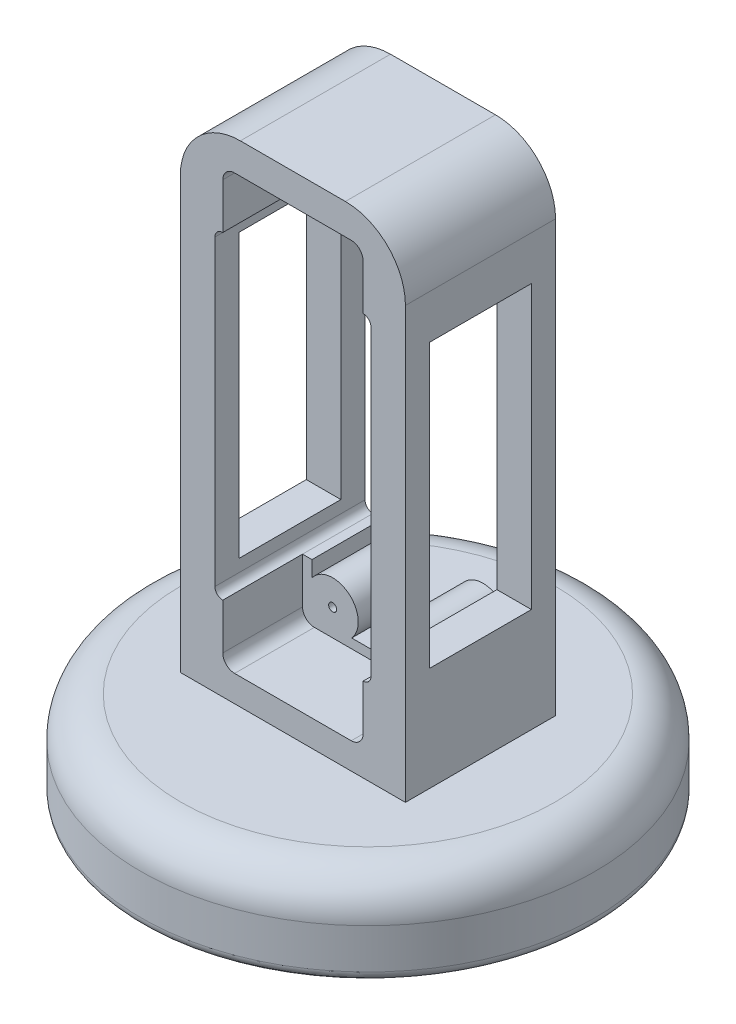
from build123d import *

# Parameters (mm, degrees)
BOSS_EXTRUDE1_DEPTH   = 19.05
SKETCH2_R             = 28.829
BOSS_EXTRUDE3_DEPTH   = 11.43
FILLET1_R             = 7.62
FILLET2_R             = 5.08
FILLET3_R             = 1.27
CAVITY4_OUTLINE_R     = 0.5
CAVITY4_DEPTH         = 19.05
CAVITY4_START         = 16.55
CAVITY4_2_OUTLINE_R   = 2.25
CAVITY4_2_OUTLINE_R_2 = 0.5
CAVITY4_2_DEPTH       = 2.5
CAVITY4_START_2       = 18.05
CAVITY4_3_DEPTH       = 1
CAVITY4_START_3       = 5.35
CAVITY4_4_OUTLINE_R   = 0.5
CAVITY4_4_DEPTH       = 11.2
CUT_EXTRUDE2_DEPTH    = 25.4
CUT_EXTRUDE3_START    = -19.558
CUT_EXTRUDE3_DEPTH    = 19.558
SKETCH6_R             = 2.25
BOSS_EXTRUDE4_DEPTH   = 2.54
SKETCH7_W             = 12.923913796
SKETCH7_H             = 35.830978878
CUT_EXTRUDE4_DEPTH    = 33.02
CUT_EXTRUDE6_START    = -5.08
SKETCH8_R             = 2.25
CUT_EXTRUDE6_DEPTH    = 5.08
SKETCH9_R             = 0.508
CUT_EXTRUDE7_DEPTH    = 17.78
CUT_EXTRUDE8_START    = -7.62
CUT_EXTRUDE8_DEPTH    = 7.62


# Read off the part's stored shape, not the designer's step: Cavity4
with BuildPart() as part:
    # Sketch1 → Boss-Extrude1 (new body)
    with BuildSketch(Plane.XY):
        Polygon((0, -31.115), (13.97, -31.115), (13.97, 0), (13.97, 31.115), (-0.624344695, 31.115), (-14.594344695, 31.115), (-14.594344695, 0), (-14.594344695, -31.115), align=None)
    extrude(amount=BOSS_EXTRUDE1_DEPTH)

    # Sketch2 → Boss-Extrude3 (add)
    with BuildSketch(Plane.XZ.offset(31.115)):
        with Locations(Location((-0.312172348, 9.525, 0), (0, 0, 270))):
            Circle(SKETCH2_R)
    extrude(amount=BOSS_EXTRUDE3_DEPTH)

    # Fillet1
    fillet1_edges = [part.edges().sort_by_distance(p)[0] for p in [
        (-14.594344695, 31.115, 9.525),
        (13.97, 31.115, 9.525),
    ]]
    fillet(fillet1_edges, radius=FILLET1_R)

    # Fillet2
    fillet2_edges = [part.edges().sort_by_distance(p)[0] for p in [
        (-0.312172348, -31.115, 38.354),
    ]]
    fillet(fillet2_edges, radius=FILLET2_R)

    # Fillet3
    fillet3_edges = [part.edges().sort_by_distance(p)[0] for p in [
        (-0.312172348, -42.545, 38.354),
    ]]
    fillet(fillet3_edges, radius=FILLET3_R)

    # Cavity4 outline → Cavity4 (cut)
    with BuildSketch(Plane.XY):
        with BuildLine():
            Line((8.593365051, 19.922544312), (-9.206634949, 19.922544312))
            ThreePointArc((-9.206634949, 19.922544312), (-9.91374173, 19.629651093), (-10.206634949, 18.922544312))
            Line((-10.206634949, 18.922544312), (-10.206634949, -19.477455688))
            ThreePointArc((-10.206634949, -19.477455688), (-9.91374173, -20.184562469), (-9.206634949, -20.477455688))
            Line((-9.206634949, -20.477455688), (8.593365051, -20.477455688))
            ThreePointArc((8.593365051, -20.477455688), (9.300471832, -20.184562469), (9.593365051, -19.477455688))
            Line((9.593365051, -19.477455688), (9.593365051, 18.922544312))
            ThreePointArc((9.593365051, 18.922544312), (9.300471832, 19.629651094), (8.593365051, 19.922544312))
        make_face()
        with Locations((-9.206634949, -19.477455688)):
            Circle(CAVITY4_OUTLINE_R, mode=Mode.SUBTRACT)
        with Locations((8.593365051, -19.477455688)):
            Circle(CAVITY4_OUTLINE_R, mode=Mode.SUBTRACT)
        with Locations((-9.206634949, 18.922544312)):
            Circle(CAVITY4_OUTLINE_R, mode=Mode.SUBTRACT)
        with Locations((8.593365051, 18.922544312)):
            Circle(CAVITY4_OUTLINE_R, mode=Mode.SUBTRACT)
    extrude(amount=CAVITY4_DEPTH, mode=Mode.SUBTRACT)

    # Cavity4 2 outline → Cavity4 2 (cut)
    # profile 1 of 6: a face of its own
    with BuildSketch(Plane.XY.offset(CAVITY4_START)):
        with BuildLine():
            ThreePointArc((-8.006634949, 21.929499851), (-3.337656866, 21.329809919), (-2.96721353, 26.022544312))
            Line((-2.96721353, 26.022544312), (2.353943633, 26.022544312))
            ThreePointArc((2.353943633, 26.022544312), (2.724386969, 21.329809919), (7.393365051, 21.929499851))
            Line((7.393365051, 21.929499851), (7.393365051, 19.922544312))
            Line((7.393365051, 19.922544312), (8.593365051, 19.922544312))
            Line((8.593365051, 19.922544312), (8.593365051, 25.722544312))
            ThreePointArc((8.593365051, 25.722544312), (8.154025223, 26.783204484), (7.093365051, 27.222544312))
            Line((7.093365051, 27.222544312), (-7.706634949, 27.222544312))
            ThreePointArc((-7.706634949, 27.222544312), (-8.76729512, 26.783204484), (-9.206634949, 25.722544312))
            Line((-9.206634949, 25.722544312), (-9.206634949, 19.922544312))
            Line((-9.206634949, 19.922544312), (-8.006634949, 19.922544312))
            Line((-8.006634949, 19.922544312), (-8.006634949, 21.929499851))
        make_face()
        with Locations((-5.386634949, 23.852544312)):
            Circle(CAVITY4_2_OUTLINE_R, mode=Mode.SUBTRACT)
        with Locations((4.773365051, 23.852544312)):
            Circle(CAVITY4_2_OUTLINE_R, mode=Mode.SUBTRACT)
    # profile 2 of 6: a face of its own
    with BuildSketch(Plane.XY.offset(CAVITY4_START)):
        with BuildLine():
            Line((-8.006634949, -20.477455688), (-9.206634949, -20.477455688))
            Line((-9.206634949, -20.477455688), (-9.206634949, -26.277455688))
            ThreePointArc((-9.206634949, -26.277455688), (-8.76729512, -27.33811586), (-7.706634949, -27.777455688))
            Line((-7.706634949, -27.777455688), (7.093365051, -27.777455688))
            ThreePointArc((7.093365051, -27.777455688), (8.154025223, -27.33811586), (8.593365051, -26.277455688))
            Line((8.593365051, -26.277455688), (8.593365051, -20.477455688))
            Line((8.593365051, -20.477455688), (7.393365051, -20.477455688))
            Line((7.393365051, -20.477455688), (7.393365051, -22.484411227))
            ThreePointArc((7.393365051, -22.484411227), (2.724386969, -21.884721295), (2.353943633, -26.577455688))
            Line((2.353943633, -26.577455688), (-2.96721353, -26.577455688))
            ThreePointArc((-2.96721353, -26.577455688), (-3.337656866, -21.884721295), (-8.006634949, -22.484411227))
            Line((-8.006634949, -22.484411227), (-8.006634949, -20.477455688))
        make_face()
        with Locations((-5.386634949, -24.407455688)):
            Circle(CAVITY4_2_OUTLINE_R, mode=Mode.SUBTRACT)
        with Locations((4.773365051, -24.407455688)):
            Circle(CAVITY4_2_OUTLINE_R, mode=Mode.SUBTRACT)
    # profile 3 of 6: a face of its own
    with BuildSketch(Plane.XY.offset(CAVITY4_START)):
        with Locations((-9.206634949, -19.477455688)):
            Circle(CAVITY4_2_OUTLINE_R_2)
    # profile 4 of 6: a face of its own
    with BuildSketch(Plane.XY.offset(CAVITY4_START)):
        with Locations((-9.206634949, 18.922544312)):
            Circle(CAVITY4_2_OUTLINE_R_2)
    # profile 5 of 6: a face of its own
    with BuildSketch(Plane.XY.offset(CAVITY4_START)):
        with Locations((8.593365051, 18.922544312)):
            Circle(CAVITY4_2_OUTLINE_R_2)
    # profile 6 of 6: a face of its own
    with BuildSketch(Plane.XY.offset(CAVITY4_START)):
        with Locations((8.593365051, -19.477455688)):
            Circle(CAVITY4_2_OUTLINE_R_2)
    extrude(amount=CAVITY4_2_DEPTH, mode=Mode.SUBTRACT)

    # Cavity4 3 outline → Cavity4 3 (cut)
    with BuildSketch(Plane.XY.offset(CAVITY4_START_2)):
        with BuildLine():
            Line((2.353943633, 26.022544312), (-2.96721353, 26.022544312))
            ThreePointArc((-2.96721353, 26.022544312), (-3.337656866, 21.329809919), (-8.006634949, 21.929499851))
            Line((-8.006634949, 21.929499851), (-8.006634949, 19.922544312))
            Line((-8.006634949, 19.922544312), (7.393365051, 19.922544312))
            Line((7.393365051, 19.922544312), (7.393365051, 21.929499851))
            ThreePointArc((7.393365051, 21.929499851), (2.724386969, 21.329809919), (2.353943633, 26.022544312))
        make_face()
        with BuildLine():
            Line((7.393365051, -20.477455688), (-8.006634949, -20.477455688))
            Line((-8.006634949, -20.477455688), (-8.006634949, -22.484411227))
            ThreePointArc((-8.006634949, -22.484411227), (-3.337656866, -21.884721295), (-2.96721353, -26.577455688))
            Line((-2.96721353, -26.577455688), (2.353943633, -26.577455688))
            ThreePointArc((2.353943633, -26.577455688), (2.724386969, -21.884721295), (7.393365051, -22.484411227))
            Line((7.393365051, -22.484411227), (7.393365051, -20.477455688))
        make_face()
    extrude(amount=CAVITY4_3_DEPTH, mode=Mode.SUBTRACT)

    # Cavity4 4 outline → Cavity4 4 (cut)
    with BuildSketch(Plane.XY.offset(CAVITY4_START_3)):
        with Locations((-9.206634949, -19.477455688)):
            Circle(CAVITY4_4_OUTLINE_R)
        with Locations((-9.206634949, 18.922544312)):
            Circle(CAVITY4_4_OUTLINE_R)
        with Locations((8.593365051, 18.922544312)):
            Circle(CAVITY4_4_OUTLINE_R)
        with Locations((8.593365051, -19.477455688)):
            Circle(CAVITY4_4_OUTLINE_R)
    extrude(amount=CAVITY4_4_DEPTH, mode=Mode.SUBTRACT)

    # Sketch4 → Cut-Extrude2 (cut)
    with BuildSketch(Plane.XY.offset(19.05)):
        Polygon((-9.79576072, 19.507329281), (9.123068143, 19.507329281), (9.123068143, -20.023079802), (-9.743960735, -20.023079802), align=None)
    extrude(amount=-CUT_EXTRUDE2_DEPTH, mode=Mode.SUBTRACT)

    # Sketch5 → Cut-Extrude3 (cut)
    with BuildSketch(Plane.XY.offset(18.05).offset(CUT_EXTRUDE3_START)):
        with BuildLine():
            Line((7.393365051, -20.477455688), (-8.006634949, -20.477455688))
            Line((-8.006634949, -20.477455688), (-8.006634949, -22.484411227))
            ThreePointArc((-8.006634949, -22.484411227), (-3.337656866, -21.884721295), (-2.96721353, -26.577455688))
            Line((-2.96721353, -26.577455688), (2.353943633, -26.577455688))
            ThreePointArc((2.353943633, -26.577455688), (2.724386969, -21.884721295), (7.393365051, -22.484411227))
            Line((7.393365051, -22.484411227), (7.393365051, -20.477455688))
        make_face()
        with BuildLine():
            Line((2.353943633, 26.022544312), (-2.96721353, 26.022544312))
            ThreePointArc((-2.96721353, 26.022544312), (-3.337656866, 21.329809919), (-8.006634949, 21.929499851))
            Line((-8.006634949, 21.929499851), (-8.006634949, 19.922544312))
            Line((-8.006634949, 19.922544312), (7.393365051, 19.922544312))
            Line((7.393365051, 19.922544312), (7.393365051, 21.929499851))
            ThreePointArc((7.393365051, 21.929499851), (2.724386969, 21.329809919), (2.353943633, 26.022544312))
        make_face()
    extrude(amount=CUT_EXTRUDE3_DEPTH, mode=Mode.SUBTRACT)

    # Sketch6 → Boss-Extrude4 (add)
    with BuildSketch(Plane.XY.offset(19.05)):
        with Locations(Location((4.773365051, -24.407455688, 0), (0, 0, 180))):
            Circle(SKETCH6_R)
        with Locations(Location((-5.386634949, -24.407455688, 0), (0, 0, 180))):
            Circle(SKETCH6_R)
        with Locations(Location((4.773365051, 23.852544312, 0), (0, 0, 180))):
            Circle(SKETCH6_R)
        with Locations(Location((-5.386634949, 23.852544312, 0), (0, 0, 180))):
            Circle(SKETCH6_R)
    extrude(amount=BOSS_EXTRUDE4_DEPTH)

    # Sketch7 → Cut-Extrude4 (cut)
    with BuildSketch(Plane.ZY.offset(14.594344695)):
        with Locations((9.525, 0)):
            Rectangle(SKETCH7_W, SKETCH7_H)
    extrude(amount=-CUT_EXTRUDE4_DEPTH, mode=Mode.SUBTRACT)

    # Sketch8 → Cut-Extrude6 (cut)
    with BuildSketch(Plane.XY.offset(21.59).offset(CUT_EXTRUDE6_START)):
        with Locations((4.773365051, -24.407455688)):
            Circle(SKETCH8_R)
        with Locations((4.773365051, 23.852544312)):
            Circle(SKETCH8_R)
        with Locations((-5.386634949, 23.852544312)):
            Circle(SKETCH8_R)
        with Locations((-5.386634949, -24.407455688)):
            Circle(SKETCH8_R)
    extrude(amount=CUT_EXTRUDE6_DEPTH, mode=Mode.SUBTRACT)

    # Sketch9 → Cut-Extrude7 (cut)
    with BuildSketch(Plane.XY.offset(16.51)):
        with Locations((-5.386634949, 23.852544312)):
            Circle(SKETCH9_R)
        with Locations((4.773365051, 23.852544312)):
            Circle(SKETCH9_R)
        with Locations((4.773365051, -24.407455688)):
            Circle(SKETCH9_R)
        with Locations((-5.386634949, -24.407455688)):
            Circle(SKETCH9_R)
    extrude(amount=-CUT_EXTRUDE7_DEPTH, mode=Mode.SUBTRACT)

    # Sketch10 → Cut-Extrude8 (cut)
    with BuildSketch(Plane.XY.offset(16.55).offset(CUT_EXTRUDE8_START)):
        with BuildLine():
            Line((-7.706634949, -27.777455688), (7.093365051, -27.777455688))
            ThreePointArc((7.093365051, -27.777455688), (8.154025223, -27.33811586), (8.593365051, -26.277455688))
            Line((8.593365051, -26.277455688), (8.593365051, -20.477455688))
            Line((8.593365051, -20.477455688), (7.393365051, -20.477455688))
            Line((7.393365051, -20.477455688), (7.393365051, -22.484411227))
            ThreePointArc((7.393365051, -22.484411227), (2.724386969, -21.884721295), (2.353943633, -26.577455688))
            Line((2.353943633, -26.577455688), (-2.96721353, -26.577455688))
            ThreePointArc((-2.96721353, -26.577455688), (-3.337656866, -21.884721295), (-8.006634949, -22.484411227))
            Line((-8.006634949, -22.484411227), (-8.006634949, -20.477455688))
            Line((-8.006634949, -20.477455688), (-9.206634949, -20.477455688))
            Line((-9.206634949, -20.477455688), (-9.206634949, -26.277455688))
            ThreePointArc((-9.206634949, -26.277455688), (-8.76729512, -27.33811586), (-7.706634949, -27.777455688))
        make_face()
        with BuildLine():
            Line((7.393365051, 21.929499851), (7.393365051, 19.922544312))
            Line((7.393365051, 19.922544312), (8.593365051, 19.922544312))
            Line((8.593365051, 19.922544312), (8.593365051, 25.722544312))
            ThreePointArc((8.593365051, 25.722544312), (8.154025223, 26.783204484), (7.093365051, 27.222544312))
            Line((7.093365051, 27.222544312), (-7.706634949, 27.222544312))
            ThreePointArc((-7.706634949, 27.222544312), (-8.76729512, 26.783204484), (-9.206634949, 25.722544312))
            Line((-9.206634949, 25.722544312), (-9.206634949, 19.922544312))
            Line((-9.206634949, 19.922544312), (-8.006634949, 19.922544312))
            Line((-8.006634949, 19.922544312), (-8.006634949, 21.929499851))
            ThreePointArc((-8.006634949, 21.929499851), (-3.337656866, 21.329809919), (-2.96721353, 26.022544312))
            Line((-2.96721353, 26.022544312), (2.353943633, 26.022544312))
            ThreePointArc((2.353943633, 26.022544312), (2.724386969, 21.329809919), (7.393365051, 21.929499851))
        make_face()
    extrude(amount=CUT_EXTRUDE8_DEPTH, mode=Mode.SUBTRACT)


solid = part.part
